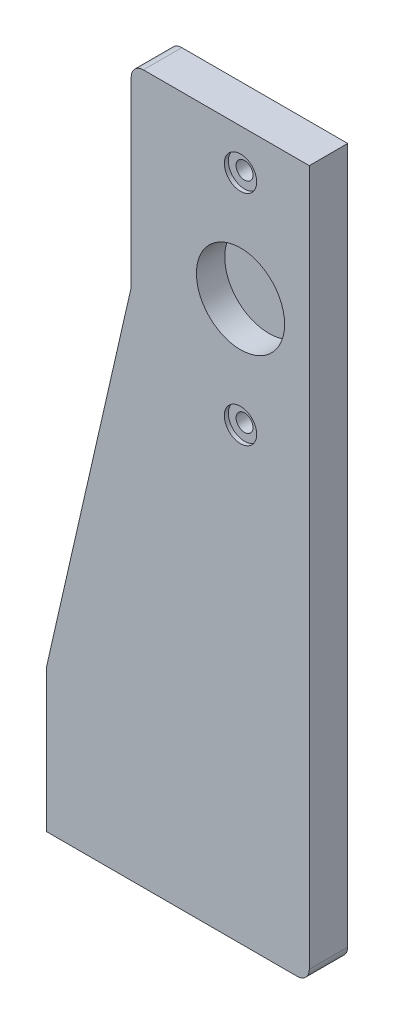
from build123d import *

# Parameters (mm, degrees)
EXTRUDE_4_DEPTH      = 9.5
SKETCH_11_R          = 2.1
CUT_EXTRUDE_8_DEPTH  = 187.923112536
SKETCH_12_R          = 4
CUT_EXTRUDE_9_DEPTH  = 1
FILLET_7_R           = 3
SKETCH_19_R          = 10.9
CUT_EXTRUDE_11_DEPTH = 7


with BuildPart() as part:
    # 草图10 → 凸台-拉伸4 (new body)
    with BuildSketch(Plane.XY):
        Polygon((0, 0), (65, 0), (65, 175), (21, 175), (21, 127), (0, 35), align=None)
    extrude(amount=EXTRUDE_4_DEPTH)

    # 草图11 → 切除-拉伸8 (cut, through all)
    with BuildSketch(Plane.XY.offset(9.5)):
        with Locations((48, 165)):
            Circle(SKETCH_11_R)
        with Locations((48, 111)):
            Circle(SKETCH_11_R)
    extrude(amount=-CUT_EXTRUDE_8_DEPTH, mode=Mode.SUBTRACT)

    # 草图12 → 切除-拉伸9 (cut)
    with BuildSketch(Plane.XY.offset(9.5)):
        with Locations((48, 165)):
            Circle(SKETCH_12_R)
        with Locations((48, 111)):
            Circle(SKETCH_12_R)
    extrude(amount=-CUT_EXTRUDE_9_DEPTH, mode=Mode.SUBTRACT)

    # 圆角7
    fillet_7_edges = [part.edges().sort_by_distance(p)[0] for p in [
        (65, 0, 4.75),
        (21, 127, 4.75),
        (21, 175, 4.75),
    ]]
    fillet(fillet_7_edges, radius=FILLET_7_R)

    # 草图19 → 切除-拉伸11 (cut)
    with BuildSketch(Plane.XY.offset(9.5)):
        with Locations((48, 138)):
            Circle(SKETCH_19_R)
    extrude(amount=-CUT_EXTRUDE_11_DEPTH, mode=Mode.SUBTRACT)


solid = part.part
